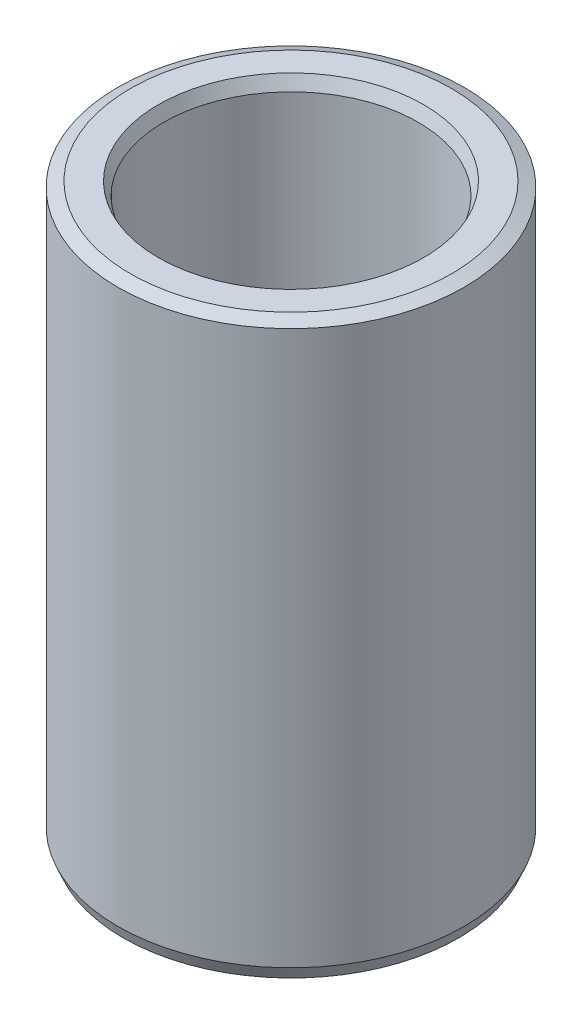
from build123d import *
from OCP.BRepFilletAPI import BRepFilletAPI_MakeChamfer

# Parameters (mm, degrees)
SKETCH1_R           = 55
BOSS_EXTRUDE1_DEPTH = 181.49084562
SKETCH2_R           = 40.425328038
CUT_EXTRUDE1_DEPTH  = 198.456139545
CHAMFER1_SIZE       = 1.68920925
CHAMFER1_SIZE2      = 4.015541238


with BuildPart() as part:
    # Sketch1 → Boss-Extrude1 (new body)
    with BuildSketch(Plane(origin=(0, 0, 0), x_dir=(1, 0, 0), z_dir=(0, 1, 0))):
        Circle(SKETCH1_R)
    extrude(amount=BOSS_EXTRUDE1_DEPTH)

    # Sketch2 → Cut-Extrude1 (cut, through all)
    with BuildSketch(Plane(origin=(0, 0, 0), x_dir=(1, 0, 0), z_dir=(0, 1, 0))):
        Circle(SKETCH2_R)
    extrude(amount=CUT_EXTRUDE1_DEPTH, mode=Mode.SUBTRACT)

    # Chamfer1: one chamfer whose edges measure the first distance from different faces: ONE call of the kernel's chamfer builder (chamfer() names one face for all edges)
    chamfer1_edges_1 = [part.edges().sort_by_distance(p)[0] for p in [
        (-40.425328038, 181.49084562, 0),
    ]]
    chamfer1_side_1 = [part.faces().sort_by_distance(p)[0] for p in [
        (-53.444365081, 181.49084562, 0),
    ]]
    chamfer1_edges_2 = [part.edges().sort_by_distance(p)[0] for p in [
        (-40.425328038, 0, 0),
    ]]
    chamfer1_side_2 = [part.faces().sort_by_distance(p)[0] for p in [
        (-40.425328038, 90.74542281, 0),
    ]]
    chamfer1_edges_3 = [part.edges().sort_by_distance(p)[0] for p in [
        (-55, 0, 0),
    ]]
    chamfer1_side_3 = [part.faces().sort_by_distance(p)[0] for p in [
        (-53.444365081, 0, 0),
    ]]
    chamfer1_edges_4 = [part.edges().sort_by_distance(p)[0] for p in [
        (-55, 181.49084562, 0),
    ]]
    chamfer1_side_4 = [part.faces().sort_by_distance(p)[0] for p in [
        (-55, 90.74542281, 0),
    ]]
    chamfer1 = BRepFilletAPI_MakeChamfer(part.part.solid().wrapped)
    for e in chamfer1_edges_1:
        chamfer1.Add(CHAMFER1_SIZE, CHAMFER1_SIZE2, e.wrapped, chamfer1_side_1[0].wrapped)  # the first distance lies on this face
    for e in chamfer1_edges_2:
        chamfer1.Add(CHAMFER1_SIZE, CHAMFER1_SIZE2, e.wrapped, chamfer1_side_2[0].wrapped)  # the first distance lies on this face
    for e in chamfer1_edges_3:
        chamfer1.Add(CHAMFER1_SIZE, CHAMFER1_SIZE2, e.wrapped, chamfer1_side_3[0].wrapped)  # the first distance lies on this face
    for e in chamfer1_edges_4:
        chamfer1.Add(CHAMFER1_SIZE, CHAMFER1_SIZE2, e.wrapped, chamfer1_side_4[0].wrapped)  # the first distance lies on this face
    add(Compound.cast(chamfer1.Shape()), mode=Mode.REPLACE)


solid = part.part
